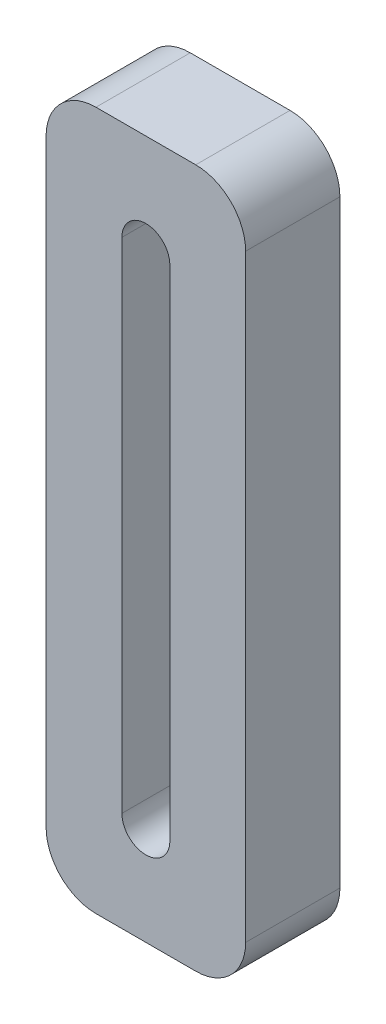
from build123d import *

# Parameters (mm, degrees)
SKETCH1_W           = 12.7
SKETCH1_H           = 44.45
BOSS_EXTRUDE1_DEPTH = 3
FILLET1_R           = 3.175


with BuildPart() as part:
    # Sketch1 → Boss-Extrude1 (new, symmetric)
    with BuildSketch(Plane.XY):
        Rectangle(SKETCH1_W, SKETCH1_H)
        with BuildLine():
            Line((1.526908397, 15.875), (1.526908397, -15.875))
            ThreePointArc((1.526908397, -15.875), (0, -17.401908397), (-1.526908397, -15.875))
            Line((-1.526908397, -15.875), (-1.526908397, 15.875))
            ThreePointArc((-1.526908397, 15.875), (0, 17.401908397), (1.526908397, 15.875))
        make_face(mode=Mode.SUBTRACT)
    extrude(amount=BOSS_EXTRUDE1_DEPTH, both=True)

    # Fillet1
    fillet1_edges = [part.edges().sort_by_distance(p)[0] for p in [
        (6.35, -22.225, 0),
        (-6.35, -22.225, 0),
        (6.35, 22.225, 0),
        (-6.35, 22.225, 0),
    ]]
    fillet(fillet1_edges, radius=FILLET1_R)


solid = part.part
